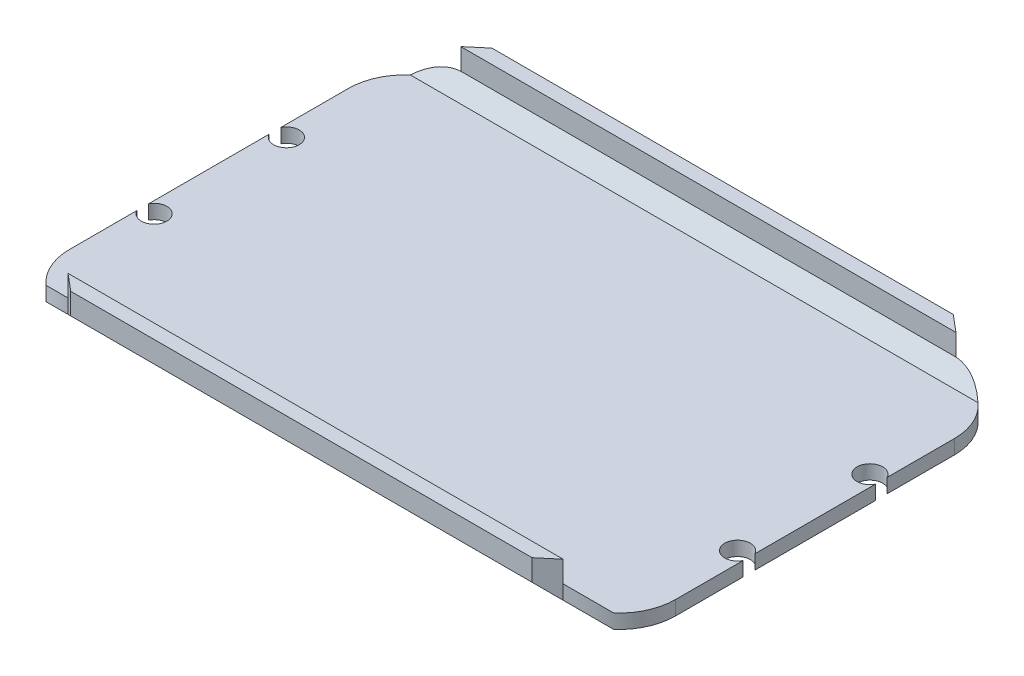
from build123d import *

# Parameters (mm, degrees)
EXTRUDE_1_DEPTH      = 1
FILLET_1_R           = 4
EXTRUDE_2_DEPTH      = 2.5
EXTRUDE_2_DEPTH_BACK = 1
CHAMFER_1_SIZE       = 2
CHAMFER_3_SIZE       = 1
CUT_EXTRUDE_1_REACH  = 28.172
SKETCH_3_R           = 0.9000000000000004


with BuildPart() as part:
    # 草图1 → 凸台-拉伸1 (new body)
    with BuildSketch(Plane(origin=(0, 0, 0), x_dir=(1, 0, 0), z_dir=(0, 1, 0))):
        Polygon((-21.300000000000004, 13.800000000000002), (21.299999999999997, 13.800000000000002), (21.3, -13.799999999999999), (-21.3, -13.799999999999999), align=None)
    extrude(amount=EXTRUDE_1_DEPTH)

    # 圆角1
    fillet_1_edges = [part.edges().sort_by_distance(p)[0] for p in [
        (21.3, 0.5, 13.799999999999999),
        (-21.3, 0.5, 13.799999999999999),
        (-21.300000000000004, 0.5, -13.800000000000002),
        (21.299999999999997, 0.5, -13.800000000000002),
    ]]
    fillet(fillet_1_edges, radius=FILLET_1_R)

    # 草图2 → 凸台-拉伸2 (add, two sides: drawn at the far end of the back side and taken through both)
    with BuildSketch(Plane(origin=(0, 1, 0), x_dir=(1, 0, 0), z_dir=(0, 1, 0)).offset(-EXTRUDE_2_DEPTH_BACK)):
        Polygon((17.4, -13.800000000000002), (16.208246407405806, -14.8), (-16.208246407405806, -14.8), (-17.4, -13.800000000000002), align=None)
        Polygon((-17.400000000000002, 13.799999999999994), (-16.208246407405802, 14.8), (16.208246407405802, 14.8), (17.400000000000002, 13.799999999999994), align=None)
    extrude(amount=EXTRUDE_2_DEPTH + EXTRUDE_2_DEPTH_BACK)

    # 倒角1
    chamfer_1_edges = [part.edges().sort_by_distance(p)[0] for p in [
        (0, 0, 14.8),
        (0, 0, -14.8),
    ]]
    chamfer(chamfer_1_edges, length=CHAMFER_1_SIZE - 0.0001)  # a hair under: the kernel refuses the full size

    # 倒角3
    chamfer_3_edges = [part.edges().sort_by_distance(p)[0] for p in [
        (-3.55e-15, 1, -13.800000000000002),
        (0, 1, 13.799999999999999),
    ]]
    chamfer(chamfer_3_edges, length=CHAMFER_3_SIZE)

    # 草图3 → 切除-拉伸1 (cut, up to next)
    with BuildSketch(Plane.XZ, mode=Mode.PRIVATE) as cut_extrude_1_sk1:
        with Locations((-20.500000000000004, 4.65)):
            Circle(SKETCH_3_R)
    cut_extrude_1_tool1 = extrude(cut_extrude_1_sk1.sketch, amount=-CUT_EXTRUDE_1_REACH, mode=Mode.PRIVATE) & part.part
    # 草图3 → 切除-拉伸1 (cut, up to next)
    with BuildSketch(Plane.XZ, mode=Mode.PRIVATE) as cut_extrude_1_sk2:
        with Locations((-20.500000000000004, -4.65)):
            Circle(SKETCH_3_R)
    cut_extrude_1_tool2 = extrude(cut_extrude_1_sk2.sketch, amount=-CUT_EXTRUDE_1_REACH, mode=Mode.PRIVATE) & part.part
    # 草图3 → 切除-拉伸1 (cut, up to next)
    with BuildSketch(Plane.XZ, mode=Mode.PRIVATE) as cut_extrude_1_sk3:
        with Locations((20.50000000000001, -4.649999999999995)):
            Circle(SKETCH_3_R)
    cut_extrude_1_tool3 = extrude(cut_extrude_1_sk3.sketch, amount=-CUT_EXTRUDE_1_REACH, mode=Mode.PRIVATE) & part.part
    # 草图3 → 切除-拉伸1 (cut, up to next)
    with BuildSketch(Plane.XZ, mode=Mode.PRIVATE) as cut_extrude_1_sk4:
        with Locations((20.500000000000004, 4.650000000000006)):
            Circle(SKETCH_3_R)
    cut_extrude_1_tool4 = extrude(cut_extrude_1_sk4.sketch, amount=-CUT_EXTRUDE_1_REACH, mode=Mode.PRIVATE) & part.part
    add(cut_extrude_1_tool1.solids().sort_by_distance((-20.5, 0, 4.65))[0], mode=Mode.SUBTRACT)
    add(cut_extrude_1_tool2.solids().sort_by_distance((-20.5, 0, -4.65))[0], mode=Mode.SUBTRACT)
    add(cut_extrude_1_tool3.solids().sort_by_distance((20.5, 0, -4.65))[0], mode=Mode.SUBTRACT)
    add(cut_extrude_1_tool4.solids().sort_by_distance((20.5, 0, 4.65))[0], mode=Mode.SUBTRACT)


solid = part.part
